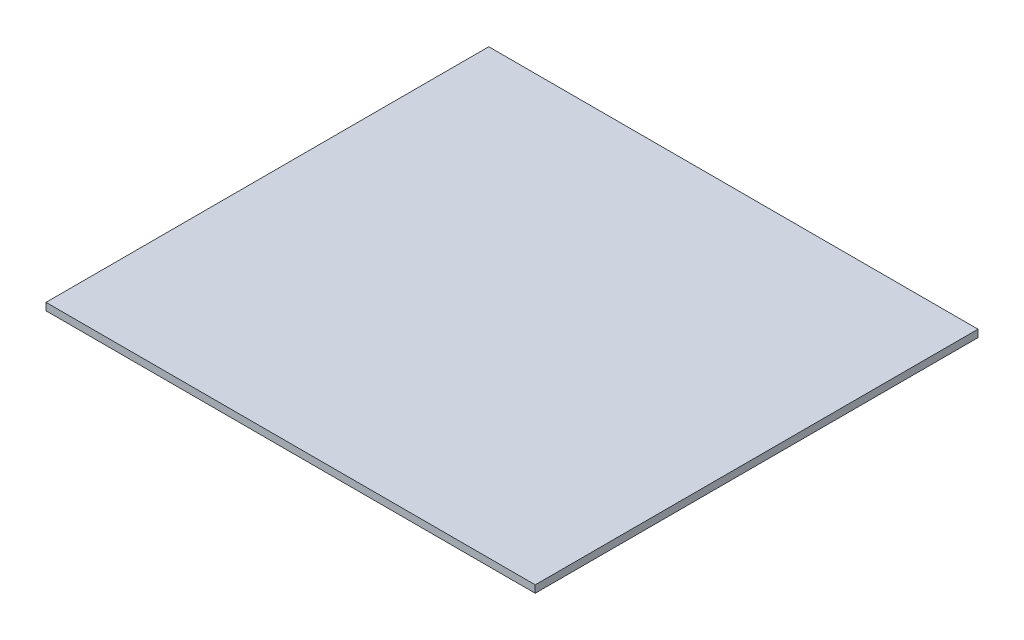
from build123d import *

# Parameters (mm, degrees)
SKETCH1_W           = 200
SKETCH1_H           = 181
BOSS_EXTRUDE1_DEPTH = 3


with BuildPart() as part:
    # Sketch1 → Boss-Extrude1 (new body)
    with BuildSketch(Plane(origin=(0, 0, 0), x_dir=(1, 0, 0), z_dir=(0, 1, 0))):
        with Locations((100, 90.5)):
            Rectangle(SKETCH1_W, SKETCH1_H)
    extrude(amount=BOSS_EXTRUDE1_DEPTH)


solid = part.part
